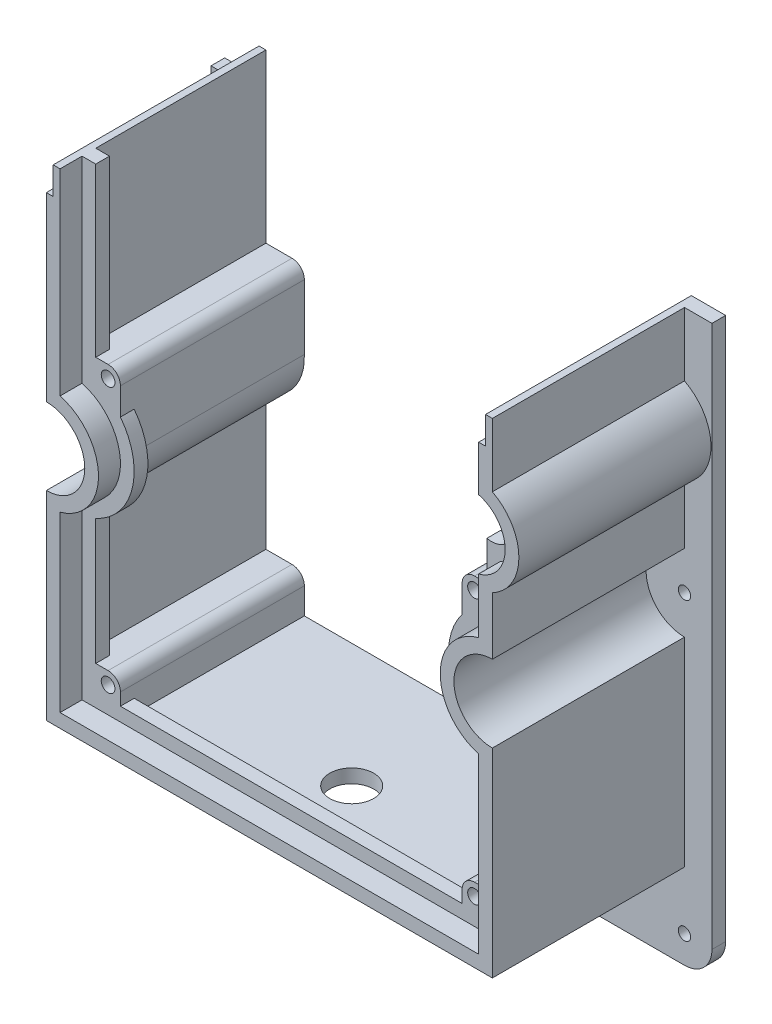
from build123d import *

# Parameters (mm, degrees)
SKETCH1_R               = 2.25
SKETCH1_R_2             = 7.9375
BOSS_EXTRUDE1_DEPTH     = 5
BOSS_EXTRUDE2_DEPTH     = 70
SKETCH3_R               = 8
CUT_EXTRUDE1_DEPTH      = 398.254952325
CUT_EXTRUDE2_DEPTH      = 1209.654326614
SKETCH5_R               = 7.9375
CUT_EXTRUDE3_DEPTH      = 1209.654326614
BOSS_EXTRUDE4_DEPTH     = 5
BOSS_EXTRUDE5_START     = -67
BOSS_EXTRUDE5_OUTLINE_R = 2.5
BOSS_EXTRUDE5_DEPTH     = 67
CUT_EXTRUDE4_DEPTH      = 1209.654326614
CUT_EXTRUDE4_DEPTH_BACK = 1209.654326614
CUT_EXTRUDE5_DEPTH      = 1209.654326614


# Read off the part's stored shape, not the designer's step: Boss-Extrude5
with BuildPart() as part:
    # Sketch1 → Boss-Extrude1 (new body)
    with BuildSketch(Plane.XY):
        with BuildLine():
            Line((-66.080112923, -1201.56262), (96.419887077, -1201.56262))
            ThreePointArc((96.419887077, -1201.56262), (106.319382013, -1197.462114937), (110.419887077, -1187.56262))
            Line((110.419887077, -1187.56262), (110.419887077, -812.43738))
            ThreePointArc((110.419887077, -812.43738), (106.319382013, -802.537885063), (96.419887077, -798.43738))
            Line((96.419887077, -798.43738), (-66.080112923, -798.43738))
            ThreePointArc((-66.080112923, -798.43738), (-75.97960786, -802.537885063), (-80.080112923, -812.43738))
            Line((-80.080112923, -812.43738), (-80.080112923, -1187.56262))
            ThreePointArc((-80.080112923, -1187.56262), (-75.97960786, -1197.462114937), (-66.080112923, -1201.56262))
        make_face()
        with Locations((96.419887077, -1080)):
            Circle(SKETCH1_R, mode=Mode.SUBTRACT)
        with Locations((88.147808187, -1029.0799835)):
            Circle(SKETCH1_R_2, mode=Mode.SUBTRACT)
        with Locations((-66.080112923, -1080)):
            Circle(SKETCH1_R, mode=Mode.SUBTRACT)
        with Locations((96.419887077, -920)):
            Circle(SKETCH1_R, mode=Mode.SUBTRACT)
        with Locations((-66.080112923, -920)):
            Circle(SKETCH1_R, mode=Mode.SUBTRACT)
        with Locations((-66.080112923, -1187.56262)):
            Circle(SKETCH1_R, mode=Mode.SUBTRACT)
        with Locations((96.419887077, -1187.56262)):
            Circle(SKETCH1_R, mode=Mode.SUBTRACT)
        with Locations((-66.080112923, -812.43738)):
            Circle(SKETCH1_R, mode=Mode.SUBTRACT)
        with Locations((96.419887077, -812.43738)):
            Circle(SKETCH1_R, mode=Mode.SUBTRACT)
    extrude(amount=-BOSS_EXTRUDE1_DEPTH)

    # Sketch2 → Boss-Extrude2 (add)
    with BuildSketch(Plane.XY):
        with BuildLine():
            Line((91.419887077, -1166.56262), (96.419887077, -1166.56262))
            Line((96.419887077, -1166.56262), (96.419887077, -1099))
            Line((96.419887077, -1099), (96.419887077, -1094))
            ThreePointArc((96.419887077, -1094), (82.419887077, -1080), (96.419887077, -1066))
            Line((96.419887077, -1066), (96.419887077, -1061))
            Line((96.419887077, -1061), (96.419887077, -1044.996221029))
            ThreePointArc((96.419887077, -1044.996221029), (106.085308187, -1029.0799835), (96.419887077, -1013.163745971))
            Line((96.419887077, -1013.163745971), (96.419887077, -939))
            Line((96.419887077, -939), (96.419887077, -934))
            ThreePointArc((96.419887077, -934), (82.419887077, -920), (96.419887077, -906))
            Line((96.419887077, -906), (96.419887077, -901))
            Line((96.419887077, -901), (96.419887077, -833.43738))
            Line((96.419887077, -833.43738), (91.419887077, -833.43738))
            Line((91.419887077, -833.43738), (-61.080112923, -833.43738))
            Line((-61.080112923, -833.43738), (-66.080112923, -833.43738))
            Line((-66.080112923, -833.43738), (-66.080112923, -901))
            Line((-66.080112923, -901), (-66.080112923, -906))
            ThreePointArc((-66.080112923, -906), (-56.180617987, -910.100505063), (-52.080112923, -920))
            ThreePointArc((-52.080112923, -920), (-56.180617987, -929.899494937), (-66.080112923, -934))
            Line((-66.080112923, -934), (-66.080112923, -939))
            Line((-66.080112923, -939), (-66.080112923, -1061))
            Line((-66.080112923, -1061), (-66.080112923, -1066))
            ThreePointArc((-66.080112923, -1066), (-56.180617987, -1070.100505063), (-52.080112923, -1080))
            ThreePointArc((-52.080112923, -1080), (-56.180617987, -1089.899494937), (-66.080112923, -1094))
            Line((-66.080112923, -1094), (-66.080112923, -1099))
            Line((-66.080112923, -1099), (-66.080112923, -1166.56262))
            Line((-66.080112923, -1166.56262), (-61.080112923, -1166.56262))
            Line((-61.080112923, -1166.56262), (91.419887077, -1166.56262))
        make_face()
        with BuildLine():
            Line((91.419887077, -1098.33030278), (91.419887077, -1161.56262))
            Line((91.419887077, -1161.56262), (-61.080112923, -1161.56262))
            Line((-61.080112923, -1161.56262), (-61.080112923, -1098.33030278))
            ThreePointArc((-61.080112923, -1098.33030278), (-47.080112923, -1080), (-61.080112923, -1061.66969722))
            Line((-61.080112923, -1061.66969722), (-61.080112923, -938.33030278))
            ThreePointArc((-61.080112923, -938.33030278), (-47.080112923, -920), (-61.080112923, -901.66969722))
            Line((-61.080112923, -901.66969722), (-61.080112923, -838.43738))
            Line((-61.080112923, -838.43738), (91.419887077, -838.43738))
            Line((91.419887077, -838.43738), (91.419887077, -901.66969722))
            ThreePointArc((91.419887077, -901.66969722), (77.419887077, -920), (91.419887077, -938.33030278))
            Line((91.419887077, -938.33030278), (91.419887077, -1011.443447389))
            Line((91.419887077, -1011.443447389), (91.419887077, -1016.563098664))
            ThreePointArc((91.419887077, -1016.563098664), (94.061132369, -1017.572963757), (96.419887077, -1019.132540759))
            ThreePointArc((96.419887077, -1019.132540759), (99.861025654, -1023.586401535), (101.085308187, -1029.0799835))
            ThreePointArc((101.085308187, -1029.0799835), (99.861025654, -1034.573565465), (96.419887077, -1039.027426241))
            ThreePointArc((96.419887077, -1039.027426241), (94.061132369, -1040.587003243), (91.419887077, -1041.596868336))
            Line((91.419887077, -1041.596868336), (91.419887077, -1046.716519611))
            Line((91.419887077, -1046.716519611), (91.419887077, -1061.66969722))
            ThreePointArc((91.419887077, -1061.66969722), (77.419887077, -1080), (91.419887077, -1098.33030278))
        make_face(mode=Mode.SUBTRACT)
    extrude(amount=BOSS_EXTRUDE2_DEPTH)

    # Sketch3 → Cut-Extrude1 (cut, through all)
    with BuildSketch(Plane(origin=(0, -826.43738, 0), x_dir=(1, 0, 0), z_dir=(0, 1, 0))):
        with Locations(Location((15.169887077, -40, 0), (0, 0, 270))):
            Circle(SKETCH3_R)
    extrude(amount=-CUT_EXTRUDE1_DEPTH, mode=Mode.SUBTRACT)

    # Sketch4 → Cut-Extrude2 (cut, through all)
    with BuildSketch(Plane.XY):
        with BuildLine():
            Line((-61.080112923, -1161.56262), (91.419887077, -1161.56262))
            Line((91.419887077, -1161.56262), (91.419887077, -1098.33030278))
            ThreePointArc((91.419887077, -1098.33030278), (77.419887077, -1080), (91.419887077, -1061.66969722))
            Line((91.419887077, -1061.66969722), (91.419887077, -1046.716519611))
            ThreePointArc((91.419887077, -1046.716519611), (70.210308187, -1029.0799835), (91.419887077, -1011.443447389))
            Line((91.419887077, -1011.443447389), (91.419887077, -938.33030278))
            ThreePointArc((91.419887077, -938.33030278), (77.419887077, -920), (91.419887077, -901.66969722))
            Line((91.419887077, -901.66969722), (91.419887077, -838.43738))
            Line((91.419887077, -838.43738), (-61.080112923, -838.43738))
            Line((-61.080112923, -838.43738), (-61.080112923, -901.66969722))
            ThreePointArc((-61.080112923, -901.66969722), (-47.080112923, -920), (-61.080112923, -938.33030278))
            Line((-61.080112923, -938.33030278), (-61.080112923, -1061.66969722))
            ThreePointArc((-61.080112923, -1061.66969722), (-47.080112923, -1080), (-61.080112923, -1098.33030278))
            Line((-61.080112923, -1098.33030278), (-61.080112923, -1161.56262))
        make_face()
    extrude(amount=-CUT_EXTRUDE2_DEPTH, mode=Mode.SUBTRACT)

    # Sketch5 → Cut-Extrude3 (cut, through all)
    # profile 1 of 2: a face of its own
    with BuildSketch(Plane.XY):
        with BuildLine():
            ThreePointArc((101.085308187, -1029.0799835), (98.387716069, -1021.172822644), (91.419887077, -1016.563098664))
            ThreePointArc((91.419887077, -1016.563098664), (75.210308187, -1029.0799835), (91.419887077, -1041.596868336))
            ThreePointArc((91.419887077, -1041.596868336), (98.387716069, -1036.987144356), (101.085308187, -1029.0799835))
        make_face()
        with Locations((88.147808187, -1029.0799835)):
            Circle(SKETCH5_R, mode=Mode.SUBTRACT)
    # profile 2 of 2: a face of its own
    with BuildSketch(Plane.XY):
        with BuildLine():
            Line((91.419887077, -1016.563098664), (91.419887077, -1011.443447389))
            ThreePointArc((91.419887077, -1011.443447389), (70.210308187, -1029.0799835), (91.419887077, -1046.716519611))
            Line((91.419887077, -1046.716519611), (91.419887077, -1041.596868336))
            ThreePointArc((91.419887077, -1041.596868336), (75.210308187, -1029.0799835), (91.419887077, -1016.563098664))
        make_face()
    extrude(amount=-CUT_EXTRUDE3_DEPTH, mode=Mode.SUBTRACT)

    # Sketch9 → Boss-Extrude4 (add)
    with BuildSketch(Plane.XY.offset(62)):
        with BuildLine():
            Line((-61.080112923, -1098.33030278), (-61.080112923, -1161.56262))
            Line((-61.080112923, -1161.56262), (91.419887077, -1161.56262))
            Line((91.419887077, -1161.56262), (91.419887077, -1098.33030278))
            ThreePointArc((91.419887077, -1098.33030278), (77.419887077, -1080), (91.419887077, -1061.66969722))
            Line((91.419887077, -1061.66969722), (91.419887077, -1041.596868336))
            ThreePointArc((91.419887077, -1041.596868336), (101.085308187, -1029.0799835), (91.419887077, -1016.563098664))
            Line((91.419887077, -1016.563098664), (91.419887077, -938.33030278))
            ThreePointArc((91.419887077, -938.33030278), (77.419887077, -920), (91.419887077, -901.66969722))
            Line((91.419887077, -901.66969722), (91.419887077, -838.43738))
            Line((91.419887077, -838.43738), (-61.080112923, -838.43738))
            Line((-61.080112923, -838.43738), (-61.080112923, -901.66969722))
            ThreePointArc((-61.080112923, -901.66969722), (-47.080112923, -920), (-61.080112923, -938.33030278))
            Line((-61.080112923, -938.33030278), (-61.080112923, -1061.66969722))
            ThreePointArc((-61.080112923, -1061.66969722), (-47.080112923, -1080), (-61.080112923, -1098.33030278))
        make_face()
        with BuildLine():
            Line((86.419887077, -843.43738), (-56.080112923, -843.43738))
            Line((-56.080112923, -843.43738), (-56.080112923, -898.182575771))
            ThreePointArc((-56.080112923, -898.182575771), (-42.080112923, -920), (-56.080112923, -941.817424229))
            Line((-56.080112923, -941.817424229), (-56.080112923, -1058.182575771))
            ThreePointArc((-56.080112923, -1058.182575771), (-42.080112923, -1080), (-56.080112923, -1101.817424229))
            Line((-56.080112923, -1101.817424229), (-56.080112923, -1156.56262))
            Line((-56.080112923, -1156.56262), (86.419887077, -1156.56262))
            Line((86.419887077, -1156.56262), (86.419887077, -1101.817424229))
            ThreePointArc((86.419887077, -1101.817424229), (72.419887077, -1080), (86.419887077, -1058.182575771))
            Line((86.419887077, -1058.182575771), (86.419887077, -1036.827124578))
            ThreePointArc((86.419887077, -1036.827124578), (96.085308187, -1029.0799835), (86.419887077, -1021.332842422))
            Line((86.419887077, -1021.332842422), (86.419887077, -941.817424229))
            ThreePointArc((86.419887077, -941.817424229), (72.419887077, -920), (86.419887077, -898.182575771))
            Line((86.419887077, -898.182575771), (86.419887077, -843.43738))
        make_face(mode=Mode.SUBTRACT)
    extrude(amount=-BOSS_EXTRUDE4_DEPTH)

    # Boss-Extrude5 outline → Boss-Extrude5 (add)
    # profile 1 of 8: a face of its own
    with BuildSketch(Plane(origin=(0, 0, -5), x_dir=(-1, 0, 0), z_dir=(0, 0, -1)).offset(BOSS_EXTRUDE5_START)):
        with BuildLine():
            ThreePointArc((-77.419887077, -1152.06262), (-78.737906562, -1148.880639485), (-81.919887077, -1147.56262))
            Line((-81.919887077, -1147.56262), (-91.419887077, -1147.56262))
            Line((-91.419887077, -1147.56262), (-91.419887077, -1161.56262))
            Line((-91.419887077, -1161.56262), (-77.419887077, -1161.56262))
            Line((-77.419887077, -1161.56262), (-77.419887077, -1152.06262))
        make_face()
        with Locations((-81.919887077, -1152.06262)):
            Circle(BOSS_EXTRUDE5_OUTLINE_R, mode=Mode.SUBTRACT)
    # profile 2 of 8: a face of its own
    with BuildSketch(Plane(origin=(0, 0, -5), x_dir=(-1, 0, 0), z_dir=(0, 0, -1)).offset(BOSS_EXTRUDE5_START)):
        with BuildLine():
            Line((-81.919887077, -1050.964311707), (-91.419887077, -1050.964311707))
            Line((-91.419887077, -1050.964311707), (-91.419887077, -1061.66969722))
            ThreePointArc((-91.419887077, -1061.66969722), (-81.320218206, -1068.467437405), (-77.419887077, -1080))
            Line((-77.419887077, -1080), (-77.419887077, -1055.464311707))
            ThreePointArc((-77.419887077, -1055.464311707), (-78.737906561, -1052.282331191), (-81.919887077, -1050.964311707))
        make_face()
        with Locations((-81.919887077, -1055.464311707)):
            Circle(BOSS_EXTRUDE5_OUTLINE_R, mode=Mode.SUBTRACT)
    # profile 3 of 8: a face of its own
    with BuildSketch(Plane(origin=(0, 0, -5), x_dir=(-1, 0, 0), z_dir=(0, 0, -1)).offset(BOSS_EXTRUDE5_START)):
        with BuildLine():
            Line((61.080112923, -1147.56262), (51.580112923, -1147.56262))
            ThreePointArc((51.580112923, -1147.56262), (48.398132408, -1148.880639485), (47.080112923, -1152.06262))
            Line((47.080112923, -1152.06262), (47.080112923, -1161.56262))
            Line((47.080112923, -1161.56262), (61.080112923, -1161.56262))
            Line((61.080112923, -1161.56262), (61.080112923, -1147.56262))
        make_face()
        with Locations((51.580112923, -1152.06262)):
            Circle(BOSS_EXTRUDE5_OUTLINE_R, mode=Mode.SUBTRACT)
    # profile 4 of 8: a face of its own
    with BuildSketch(Plane(origin=(0, 0, -5), x_dir=(-1, 0, 0), z_dir=(0, 0, -1)).offset(BOSS_EXTRUDE5_START)):
        with BuildLine():
            Line((61.080112923, -1050.964311707), (51.580112923, -1050.964311707))
            ThreePointArc((51.580112923, -1050.964311707), (48.398132408, -1052.282331192), (47.080112923, -1055.464311707))
            Line((47.080112923, -1055.464311707), (47.101209294, -1079.104892724))
            ThreePointArc((47.101209294, -1079.104892724), (51.256366252, -1068.114860765), (61.080112923, -1061.66969722))
            Line((61.080112923, -1061.66969722), (61.080112923, -1050.964311707))
        make_face()
        with Locations((51.580112923, -1055.464311707)):
            Circle(BOSS_EXTRUDE5_OUTLINE_R, mode=Mode.SUBTRACT)
    # profile 5 of 8: a face of its own
    with BuildSketch(Plane(origin=(0, 0, -5), x_dir=(-1, 0, 0), z_dir=(0, 0, -1)).offset(BOSS_EXTRUDE5_START)):
        with BuildLine():
            Line((47.080112923, -920), (47.080112923, -944.535688293))
            ThreePointArc((47.080112923, -944.535688293), (48.398132408, -947.717668808), (51.580112923, -949.035688293))
            Line((51.580112923, -949.035688293), (61.080112923, -949.035688293))
            Line((61.080112923, -949.035688293), (61.080112923, -938.33030278))
            ThreePointArc((61.080112923, -938.33030278), (50.980444052, -931.532562595), (47.080112923, -920))
        make_face()
        with Locations((51.580112923, -944.535688293)):
            Circle(BOSS_EXTRUDE5_OUTLINE_R, mode=Mode.SUBTRACT)
    # profile 6 of 8: a face of its own
    with BuildSketch(Plane(origin=(0, 0, -5), x_dir=(-1, 0, 0), z_dir=(0, 0, -1)).offset(BOSS_EXTRUDE5_START)):
        with BuildLine():
            Line((47.080112923, -838.43738), (47.080112923, -847.93738))
            ThreePointArc((47.080112923, -847.93738), (48.398132408, -851.119360515), (51.580112923, -852.43738))
            Line((51.580112923, -852.43738), (61.080112923, -852.43738))
            Line((61.080112923, -852.43738), (61.080112923, -838.43738))
            Line((61.080112923, -838.43738), (47.080112923, -838.43738))
        make_face()
        with Locations((51.580112923, -847.93738)):
            Circle(BOSS_EXTRUDE5_OUTLINE_R, mode=Mode.SUBTRACT)
    # profile 7 of 8: a face of its own
    with BuildSketch(Plane(origin=(0, 0, -5), x_dir=(-1, 0, 0), z_dir=(0, 0, -1)).offset(BOSS_EXTRUDE5_START)):
        with BuildLine():
            Line((-91.419887077, -852.43738), (-81.919887077, -852.43738))
            ThreePointArc((-81.919887077, -852.43738), (-78.737906561, -851.119360516), (-77.419887077, -847.93738))
            Line((-77.419887077, -847.93738), (-77.419887077, -838.43738))
            Line((-77.419887077, -838.43738), (-91.419887077, -838.43738))
            Line((-91.419887077, -838.43738), (-91.419887077, -852.43738))
        make_face()
        with Locations((-81.919887077, -847.93738)):
            Circle(BOSS_EXTRUDE5_OUTLINE_R, mode=Mode.SUBTRACT)
    # profile 8 of 8: a face of its own
    with BuildSketch(Plane(origin=(0, 0, -5), x_dir=(-1, 0, 0), z_dir=(0, 0, -1)).offset(BOSS_EXTRUDE5_START)):
        with BuildLine():
            Line((-91.419887077, -949.035688293), (-81.919887077, -949.035688293))
            ThreePointArc((-81.919887077, -949.035688293), (-78.737906562, -947.717668808), (-77.419887077, -944.535688293))
            Line((-77.419887077, -944.535688293), (-77.419887077, -920))
            ThreePointArc((-77.419887077, -920), (-81.320218206, -931.532562595), (-91.419887077, -938.33030278))
            Line((-91.419887077, -938.33030278), (-91.419887077, -949.035688293))
        make_face()
        with BuildLine():
            Line((-86.415652438, -944.340511931), (-86.414971961, -944.745954498))
            ThreePointArc((-86.414971961, -944.745954498), (-86.419880739, -944.543240882), (-86.415652438, -944.340511931))
        make_face(mode=Mode.SUBTRACT)
        with Locations((-81.919887077, -944.535688293)):
            Circle(BOSS_EXTRUDE5_OUTLINE_R, mode=Mode.SUBTRACT)
    extrude(amount=BOSS_EXTRUDE5_DEPTH)

    # Sketch13 → Cut-Extrude4 (cut, two sides: drawn at the far end of the back side and taken through both)
    with BuildSketch(Plane.XY.offset(-CUT_EXTRUDE4_DEPTH_BACK)):
        Polygon((79.656129504, -990), (85.376212354, -990), (85.376212354, -1000), (93.919887077, -1000), (93.919887077, -990), (125.759643806, -990), (156.017038922, -946.409946928), (140.844176056, -764.335592536), (-160.217366075, -779.508455402), (-87.250309621, -1000), (-63.580112923, -1000), (-63.580112923, -990), (-53.580112923, -990), align=None)
    extrude(amount=CUT_EXTRUDE4_DEPTH + CUT_EXTRUDE4_DEPTH_BACK, mode=Mode.SUBTRACT)

    # Sketch14 → Cut-Extrude5 (cut, through all)
    with BuildSketch(Plane.XY):
        with BuildLine():
            Line((-76.080112923, -1000), (-99.934841828, -976.145271096))
            Line((-99.934841828, -976.145271096), (-120.553195013, -1197.56262))
            Line((-120.553195013, -1197.56262), (143.805321598, -1261.370087687))
            Line((143.805321598, -1261.370087687), (228.336918045, -1143.906616043))
            Line((228.336918045, -1143.906616043), (164.81819016, -1009.618062681))
            Line((164.81819016, -1009.618062681), (130.094214546, -955.630748168))
            Line((130.094214546, -955.630748168), (106.419887077, -990))
            Line((106.419887077, -990), (106.419887077, -1187.56262))
            ThreePointArc((106.419887077, -1187.56262), (103.490954888, -1194.633687812), (96.419887077, -1197.56262))
            Line((96.419887077, -1197.56262), (-66.080112923, -1197.56262))
            ThreePointArc((-66.080112923, -1197.56262), (-73.151180735, -1194.633687812), (-76.080112923, -1187.56262))
            Line((-76.080112923, -1187.56262), (-76.080112923, -1000))
        make_face()
    extrude(amount=-CUT_EXTRUDE5_DEPTH, mode=Mode.SUBTRACT)


solid = part.part
